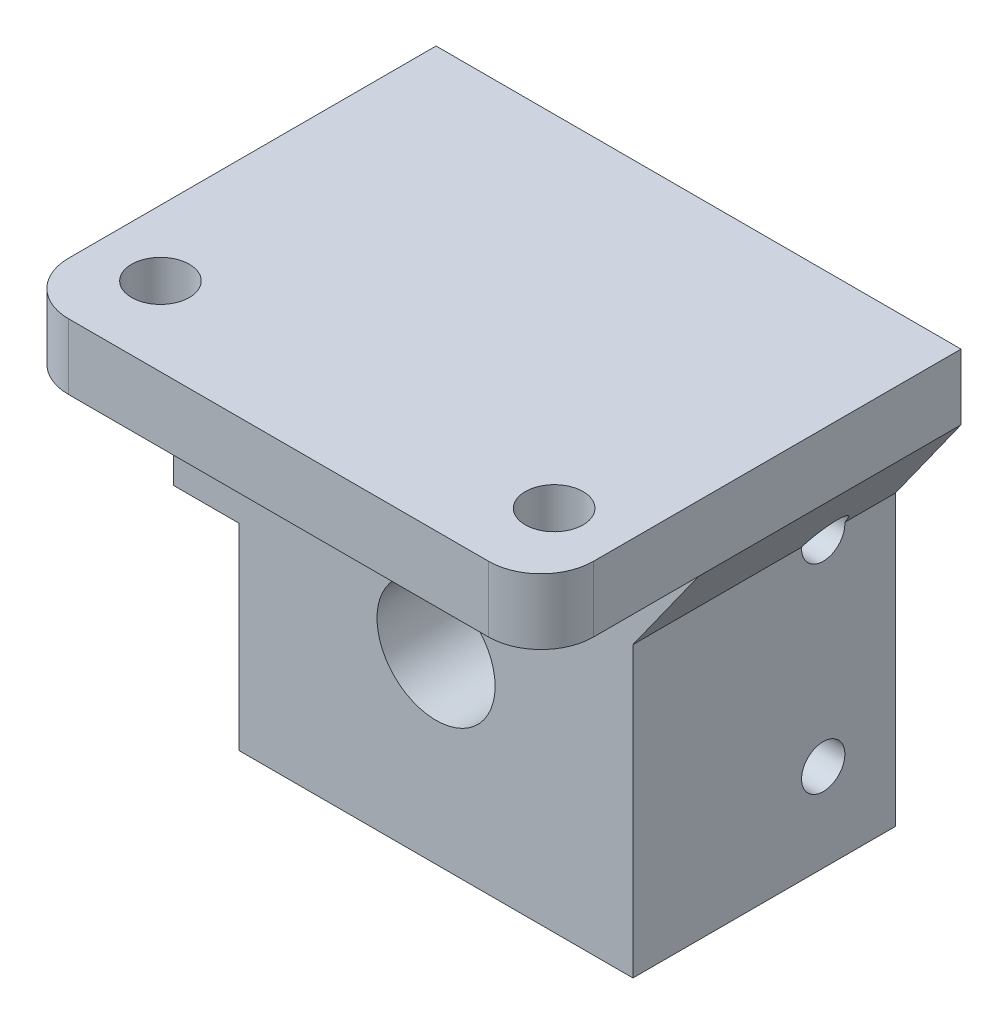
from build123d import *

# Parameters (mm, degrees)
ESQUISSE1_W                  = 40
ESQUISSE1_H                  = 34
BOSS_EXTRU_1_DEPTH           = 20
ESQUISSE2_W                  = 40
ESQUISSE2_H                  = 5
BOSS_EXTRU_3_DEPTH           = 20
ESQUISSE4_R                  = 4.5
ENL_V_MAT_EXTRU_1_DEPTH      = 34
ESQUISSE5_R                  = 8.1
ENL_V_MAT_EXTRU_2_DEPTH      = 12
ENL_V_MAT_EXTRU_3_DEPTH      = 34
ESQUISSE8_R                  = 2.2
ENL_V_MAT_EXTRU_5_DEPTH      = 54.301031885
BOSS_EXTRU_4_START           = -1
ESQUISSE10_R                 = 4.5
BOSS_EXTRU_4_DEPTH           = 1
ESQUISSE11_W                 = 40
ESQUISSE11_H                 = 8
ENL_V_MAT_EXTRU_6_DEPTH      = 54.301031885
CONG_6_R                     = 4
ENL_V_MAT_EXTRU_7_DEPTH      = 51.378566871
ENL_V_MAT_EXTRU_7_DEPTH_BACK = 51.378566871
ESQUISSE14_R                 = 1.65


with BuildPart() as part:
    # Esquisse1 → Boss.-Extru.1 (new body)
    with BuildSketch(Plane.XY):
        Rectangle(ESQUISSE1_W, ESQUISSE1_H)
    extrude(amount=BOSS_EXTRU_1_DEPTH)

    # Esquisse2 → Boss.-Extru.3 (add)
    with BuildSketch(Plane.XY.offset(20)):
        with Locations((0, 14.5)):
            Rectangle(ESQUISSE2_W, ESQUISSE2_H)
    extrude(amount=BOSS_EXTRU_3_DEPTH)

    # Esquisse4 → Enlèv. mat.-Extru.1 (cut, through all)
    with BuildSketch(Plane.XY.offset(20)):
        with Locations((0, -3)):
            Circle(ESQUISSE4_R)
    extrude(amount=-ENL_V_MAT_EXTRU_1_DEPTH, mode=Mode.SUBTRACT)

    # Esquisse5 → Enlèv. mat.-Extru.2 (cut)
    with BuildSketch(Plane(origin=(0, 0, 0), x_dir=(-1, 0, 0), z_dir=(0, 0, -1))):
        with Locations((0, -3)):
            Circle(ESQUISSE5_R)
    extrude(amount=-ENL_V_MAT_EXTRU_2_DEPTH, mode=Mode.SUBTRACT)

    # Esquisse6 → Enlèv. mat.-Extru.3 (cut, through all)
    with BuildSketch(Plane.XY.offset(20)):
        Polygon((-20, -17), (-20, -2), (-15, -2), (-15, -7), (-15, -17), align=None)
        Polygon((20, 12), (15, 5), (15, -17), (20, -17), align=None)
    extrude(amount=-ENL_V_MAT_EXTRU_3_DEPTH, mode=Mode.SUBTRACT)

    # Esquisse8 → Enlèv. mat.-Extru.5 (cut, through all)
    with BuildSketch(Plane.XZ.offset(-12)):
        with Locations((-15, 26)):
            Circle(ESQUISSE8_R)
        with Locations((15, 26)):
            Circle(ESQUISSE8_R)
    extrude(amount=-ENL_V_MAT_EXTRU_5_DEPTH, mode=Mode.SUBTRACT)

    # Esquisse10 → Boss.-Extru.4 (add)
    with BuildSketch(Plane(origin=(0, 0, 12), x_dir=(-1, 0, 0), z_dir=(0, 0, -1)).offset(BOSS_EXTRU_4_START)):
        with Locations((0, -3)):
            Circle(ESQUISSE10_R)
    extrude(amount=BOSS_EXTRU_4_DEPTH)

    # Esquisse11 → Enlèv. mat.-Extru.6 (cut, through all)
    with BuildSketch(Plane.XZ.offset(-12)):
        with Locations((0, 36)):
            Rectangle(ESQUISSE11_W, ESQUISSE11_H)
    extrude(amount=-ENL_V_MAT_EXTRU_6_DEPTH, mode=Mode.SUBTRACT)

    # Congé6
    cong_6_edges = [part.edges().sort_by_distance(p)[0] for p in [
        (-20, 14.5, 32),
        (20, 14.5, 32),
    ]]
    fillet(cong_6_edges, radius=CONG_6_R)

    # Esquisse14 → Enlèv. mat.-Extru.7 (cut, two sides: drawn at the far end of the back side and taken through both)
    with BuildSketch(Plane(origin=(15, 0, 0), x_dir=(0, 0, -1), z_dir=(1, 0, 0)).offset(-ENL_V_MAT_EXTRU_7_DEPTH_BACK)):
        with Locations((-5.5, -10.3)):
            Circle(ESQUISSE14_R)
        with Locations((-5.5, 4.9)):
            Circle(ESQUISSE14_R)
    extrude(amount=ENL_V_MAT_EXTRU_7_DEPTH + ENL_V_MAT_EXTRU_7_DEPTH_BACK, mode=Mode.SUBTRACT)


solid = part.part
